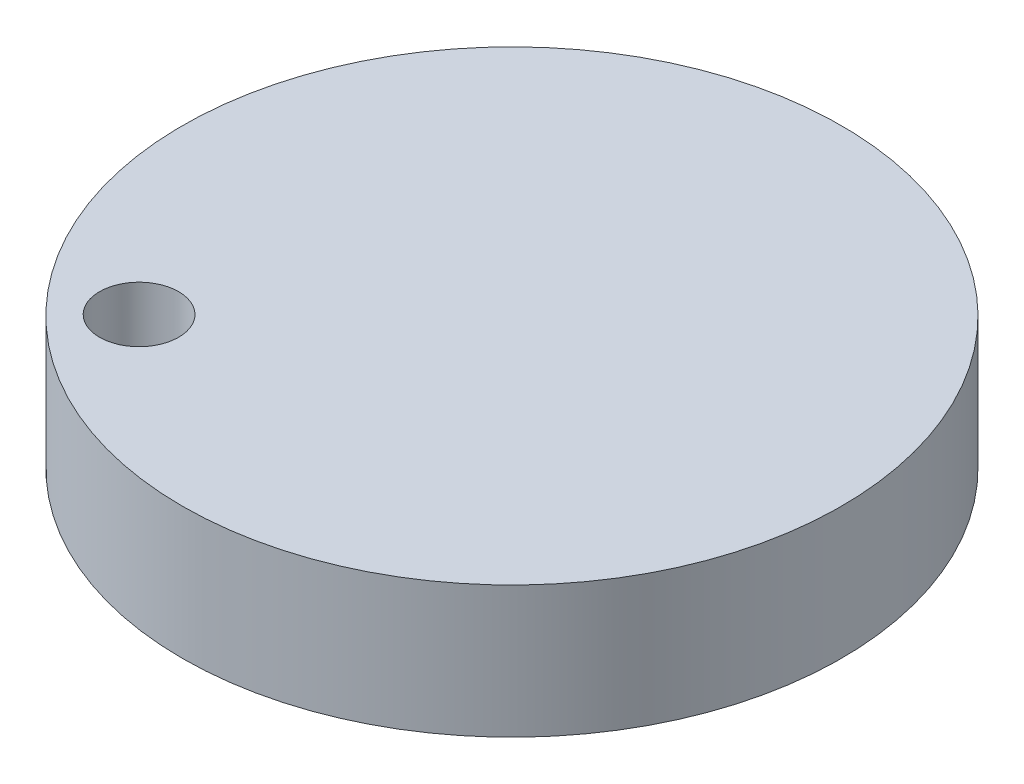
from build123d import *

# Parameters (mm, degrees)
SKETCH1_R               = 12.5
BOSS_EXTRUDE1_DEPTH     = 5
BOSS_EXTRUDE2_DEPTH     = 2
CUT_EXTRUDE1_DEPTH      = 19.371173071
CUT_EXTRUDE1_DEPTH_BACK = 19.371173071
SKETCH7_R               = 1.5


with BuildPart() as part:
    # Sketch1 → Boss-Extrude1 (new body)
    with BuildSketch(Plane(origin=(0, 0, 0), x_dir=(1, 0, 0), z_dir=(0, 1, 0))):
        Circle(SKETCH1_R)
    extrude(amount=BOSS_EXTRUDE1_DEPTH)

    # Sketch5 → Boss-Extrude2 (add)
    # profile 1 of 3: a face of its own
    with BuildSketch(Plane.XZ):
        with BuildLine():
            Line((-3.783058525, -7.698853884), (-3.656517397, -6.557691991))
            ThreePointArc((-3.656517397, -6.557691991), (0.419562601, -7.79598598), (4.586346954, -6.909584092))
            Line((4.586346954, -6.909584092), (4.398231289, -7.803613119))
            Line((4.398231289, -7.803613119), (8.835264261, -7.803613119))
            Line((8.835264261, -7.803613119), (8.835264261, -7.356598606))
            Line((8.835264261, -7.356598606), (6.332224885, -5.753540044))
            ThreePointArc((6.332224885, -5.753540044), (8.673159914, 3.981913701), (0.151933345, 9.240024976))
            ThreePointArc((0.151933345, 9.240024976), (4.587114181, -2.555573928), (-7.728040184, 0.117243971))
            ThreePointArc((-7.728040184, 0.117243971), (-7.232871747, -2.195807021), (-6.121751206, -4.284061751))
            Line((-6.121751206, -4.284061751), (-6.613956363, -5.53781326))
            Line((-6.613956363, -5.53781326), (-9.1213874, -7.458398735))
            Line((-9.1213874, -7.458398735), (-9.1213874, -7.938927068))
            Line((-9.1213874, -7.938927068), (-3.783058525, -7.938927068))
            Line((-3.783058525, -7.938927068), (-3.783058525, -7.698853884))
        make_face()
    # profile 2 of 3: a face of its own
    with BuildSketch(Plane.XZ):
        with BuildLine():
            Line((-0.950626232, 8.887896426), (-5.206948691, -1.953864639))
            ThreePointArc((-5.206948691, -1.953864639), (-6.927196969, -0.098592075), (-7.728040184, 2.301395544))
            ThreePointArc((-7.728040184, 2.301395544), (2.870290324, -1.823952142), (-0.950626232, 8.887896426))
        make_face()
        with BuildLine():
            Line((3.666799623, 0.448367609), (0.151933345, 8.626753393))
            ThreePointArc((0.151933345, 8.626753393), (3.729609724, 5.319855657), (3.666799623, 0.448367609))
        make_face(mode=Mode.SUBTRACT)
        with BuildLine():
            Line((0.032158273, 5.78996786), (2.539505861, -1.201879249))
            ThreePointArc((2.539505861, -1.201879249), (-0.130897359, -2.805707961), (-3.245572389, -2.851744431))
            Line((-3.245572389, -2.851744431), (-3.200349413, -2.443918626))
            Line((-3.200349413, -2.443918626), (0.032158273, 5.78996786))
        make_face(mode=Mode.SUBTRACT)
    # profile 3 of 3: a face of its own
    with BuildSketch(Plane.XZ):
        with BuildLine():
            Line((0.032158273, 3.12312116), (-1.245040266, 0.117243971))
            ThreePointArc((-1.245040266, 0.117243971), (0.166068053, -1.570987631), (1.577176372, 0.117243971))
            Line((1.577176372, 0.117243971), (0.032158273, 3.12312116))
        make_face()
    extrude(amount=BOSS_EXTRUDE2_DEPTH)

    # Sketch7 → Cut-Extrude1 (cut, two sides: drawn at the far end of the back side and taken through both)
    with BuildSketch(Plane.XZ.offset(-CUT_EXTRUDE1_DEPTH_BACK)):
        with Locations((-7.119157088, 7.022649241)):
            Circle(SKETCH7_R)
    extrude(amount=CUT_EXTRUDE1_DEPTH + CUT_EXTRUDE1_DEPTH_BACK, mode=Mode.SUBTRACT)


solid = part.part
